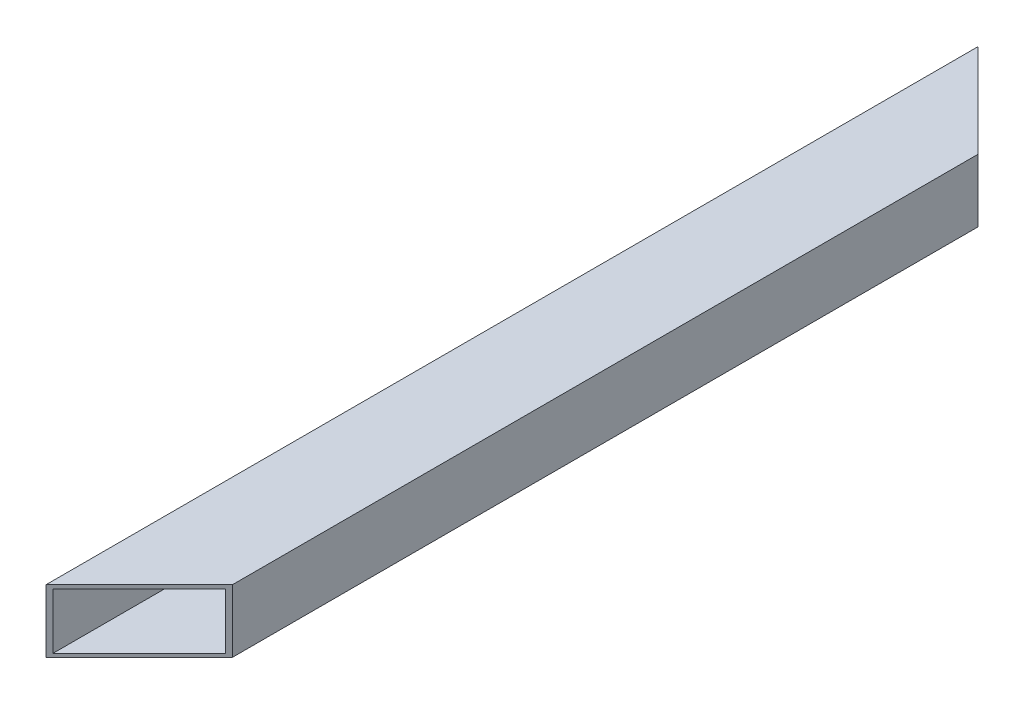
from build123d import *

# Parameters (mm, degrees)
ESQUISSE1_W             = 40
ESQUISSE1_H             = 27
ESQUISSE1_W_2           = 37
ESQUISSE1_H_2           = 24
BOSS_EXTRU_1_DEPTH      = 400
ENL_V_MAT_EXTRU_1_DEPTH = 403.900732191
ENL_V_MAT_EXTRU_3_DEPTH = 403.900732191


with BuildPart() as part:
    # Esquisse1 → Boss.-Extru.1 (new body)
    with BuildSketch(Plane.XY):
        with Locations((20, 13.5)):
            Rectangle(ESQUISSE1_W, ESQUISSE1_H)
        with Locations((20, 13.5)):
            Rectangle(ESQUISSE1_W_2, ESQUISSE1_H_2, mode=Mode.SUBTRACT)
    extrude(amount=BOSS_EXTRU_1_DEPTH)

    # Esquisse2 → Enlèv. mat.-Extru.1 (cut, through all)
    with BuildSketch(Plane(origin=(0, 0, 0), x_dir=(1, 0, 0), z_dir=(0, 1, 0))):
        Polygon((0, -400), (40, -360), (40, -400), align=None)
    extrude(amount=ENL_V_MAT_EXTRU_1_DEPTH, mode=Mode.SUBTRACT)

    # Esquisse4 → Enlèv. mat.-Extru.3 (cut, through all)
    with BuildSketch(Plane(origin=(0, 0, 0), x_dir=(1, 0, 0), z_dir=(0, 1, 0))):
        Polygon((0, 0), (40, -40), (40, 0), align=None)
    extrude(amount=ENL_V_MAT_EXTRU_3_DEPTH, mode=Mode.SUBTRACT)


solid = part.part
